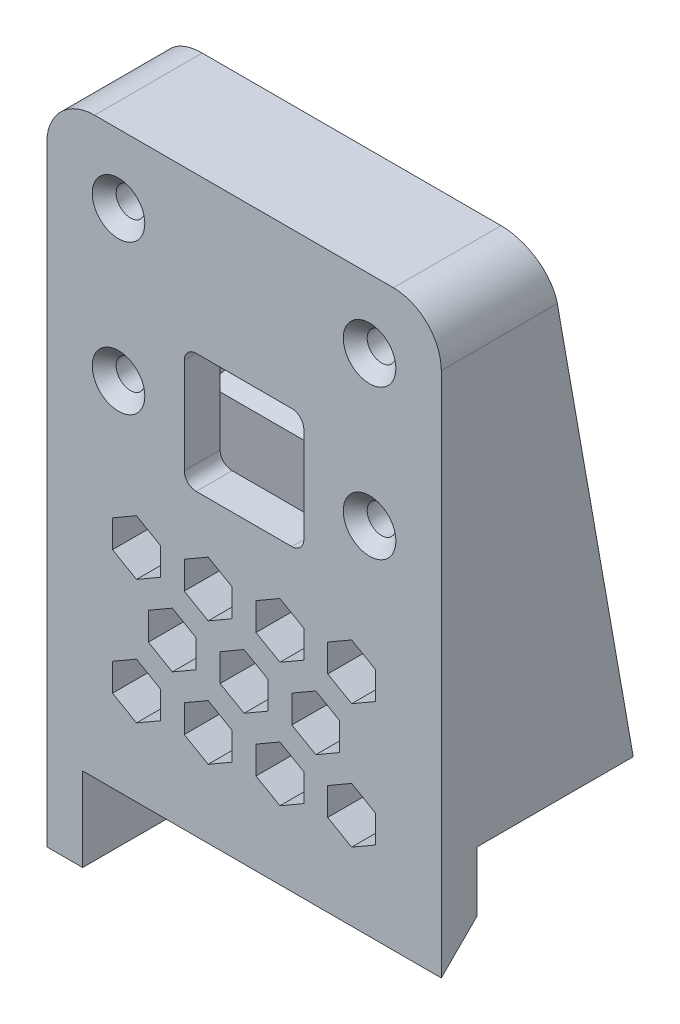
from build123d import *

# Parameters (mm, degrees)
SKETCH1_W                                       = 33
SKETCH1_H                                       = 40
BOSS_EXTRUDE1_DEPTH                             = 3
SKETCH2_W                                       = 33
SKETCH2_H                                       = 40
SKETCH2_W_2                                     = 27
SKETCH2_H_2                                     = 34
BOSS_EXTRUDE2_DEPTH                             = 3
SKETCH3_W                                       = 10
SKETCH3_H                                       = 10
CUT_EXTRUDE1_DEPTH                              = 3
CSK_FOR_M2_FLAT_HEAD_MACHINE_SCREW1_D           = 2.4
CSK_FOR_M2_FLAT_HEAD_MACHINE_SCREW1_DEPTH       = 5
CSK_FOR_M2_FLAT_HEAD_MACHINE_SCREW1_CSINK_D     = 4.4
CSK_FOR_M2_FLAT_HEAD_MACHINE_SCREW1_CSINK_ANGLE = 90
CSK_FOR_M2_FLAT_HEAD_MACHINE_SCREW1_TIP         = 0.721032743
BOSS_EXTRUDE4_DEPTH                             = 3
FILLET1_R                                       = 1
BOSS_EXTRUDE5_REACH                             = 29.809
SKETCH15_W                                      = 27
SKETCH15_H                                      = 3
SKETCH16_W                                      = 27
SKETCH16_H                                      = 3
CUT_EXTRUDE6_DEPTH                              = 3
SKETCH18_W                                      = 27
SKETCH18_H                                      = 10
BOSS_EXTRUDE6_DEPTH                             = 3
FILLET2_R                                       = 4
FILLET3_R                                       = 2
SKETCH21_W                                      = 16.053079228
SKETCH21_H                                      = 15
BOSS_EXTRUDE7_DEPTH                             = 3
CUT_EXTRUDE10_DEPTH                             = 10
SKETCH23_W                                      = 30
SKETCH23_H                                      = 8
BOSS_EXTRUDE8_DEPTH                             = 3
CHAMFER5_SIZE                                   = 3
CHAMFER6_SIZE                                   = 1
CUT_EXTRUDE12_DEPTH                             = 10


with BuildPart() as part:
    # Sketch1 → Boss-Extrude1 (new body)
    with BuildSketch(Plane.XY):
        Rectangle(SKETCH1_W, SKETCH1_H)
    extrude(amount=-BOSS_EXTRUDE1_DEPTH)

    # Sketch2 → Boss-Extrude2 (add)
    with BuildSketch(Plane(origin=(0, 0, -3), x_dir=(-1, 0, 0), z_dir=(0, 0, -1))):
        Rectangle(SKETCH2_W, SKETCH2_H)
        Rectangle(SKETCH2_W_2, SKETCH2_H_2, mode=Mode.SUBTRACT)
    extrude(amount=BOSS_EXTRUDE2_DEPTH)

    # Sketch3 → Cut-Extrude1 (cut)
    with BuildSketch(Plane.XY):
        with Locations((0, 2)):
            Rectangle(SKETCH3_W, SKETCH3_H)
    extrude(amount=-CUT_EXTRUDE1_DEPTH, mode=Mode.SUBTRACT)

    # CSK for M2 Flat Head Machine Screw1
    with Locations(Plane.XY):
        with Locations((10.5, 1.75), (10.5, 14.25), (-10.5, 1.75), (-10.5, 14.25)):
            CounterSinkHole(CSK_FOR_M2_FLAT_HEAD_MACHINE_SCREW1_D / 2, CSK_FOR_M2_FLAT_HEAD_MACHINE_SCREW1_CSINK_D / 2, depth=CSK_FOR_M2_FLAT_HEAD_MACHINE_SCREW1_DEPTH, counter_sink_angle=CSK_FOR_M2_FLAT_HEAD_MACHINE_SCREW1_CSINK_ANGLE)
            with Locations((0, 0, -(CSK_FOR_M2_FLAT_HEAD_MACHINE_SCREW1_DEPTH + CSK_FOR_M2_FLAT_HEAD_MACHINE_SCREW1_TIP / 2))):  # 118° drill point
                Cone(0, CSK_FOR_M2_FLAT_HEAD_MACHINE_SCREW1_D / 2, CSK_FOR_M2_FLAT_HEAD_MACHINE_SCREW1_TIP, mode=Mode.SUBTRACT)

    # Sketch11 → Boss-Extrude4 (add)
    with BuildSketch(Plane.ZY.offset(16.5)):
        Polygon((-6, 20), (-9, 20), (-16.053079228, -20), (-6, -20), align=None)
    boss_extrude4 = extrude(amount=-BOSS_EXTRUDE4_DEPTH)

    # Mirror1: Boss-Extrude4 across plane
    add(boss_extrude4.mirror(Plane(origin=(0, 0, 0), x_dir=(0, 0, 1), z_dir=(1, 0, 0))))

    # Fillet1
    fillet1_edges = [part.edges().sort_by_distance(p)[0] for p in [
        (5, 7, -1.5),
        (5, -3, -1.5),
        (-5, -3, -1.5),
        (-5, 7, -1.5),
    ]]
    fillet(fillet1_edges, radius=FILLET1_R)

    # Boss-Extrude5: up to this face of the body (flat: up to its plane)
    boss_extrude5_end = Plane(part.part.faces().sort_by_distance((15, 0, -12.526539614))[0])
    # Sketch15 → Boss-Extrude5 (add, up to the picked face)
    with BuildSketch(Plane(origin=(0, 0, -6), x_dir=(-1, 0, 0), z_dir=(0, 0, -1)), mode=Mode.PRIVATE) as boss_extrude5_sk1:
        with Locations((0, 18.5)):
            Rectangle(SKETCH15_W, SKETCH15_H)
    boss_extrude5_tool1 = split(extrude(boss_extrude5_sk1.sketch, amount=BOSS_EXTRUDE5_REACH, mode=Mode.PRIVATE), bisect_by=boss_extrude5_end, keep=Keep.BOTH, mode=Mode.PRIVATE)
    add(boss_extrude5_tool1.solids().sort_by(Axis((0, 18.5, -6), (0, 0, -1)))[0])

    # Sketch16 → Cut-Extrude6 (cut)
    with BuildSketch(Plane.XZ.offset(20)):
        with Locations((0, -4.5)):
            Rectangle(SKETCH16_W, SKETCH16_H)
    extrude(amount=-CUT_EXTRUDE6_DEPTH, mode=Mode.SUBTRACT)

    # Sketch18 → Boss-Extrude6 (add)
    with BuildSketch(Plane(origin=(0, 2.142164437, -12.148818227), x_dir=(-1, 0, 0), z_dir=(0, 0.17364817766692342, -0.9848077530122092))):
        with Locations((0, -11.912958374)):
            Rectangle(SKETCH18_W, SKETCH18_H)
    extrude(amount=-BOSS_EXTRUDE6_DEPTH)

    # Fillet2
    fillet2_edges = [part.edges().sort_by_distance(p)[0] for p in [
        (-16.5, 20, -4.5),
        (16.5, 20, -4.5),
    ]]
    fillet(fillet2_edges, radius=FILLET2_R)

    # Fillet3
    fillet3_edges = [part.edges().sort_by_distance(p)[0] for p in [
        (-13.5, 17, -6.264490471),
        (13.5, 17, -6.264490471),
    ]]
    fillet(fillet3_edges, radius=FILLET3_R)

    # Sketch21 → Boss-Extrude7 (add)
    with BuildSketch(Plane.ZY.offset(16.5)):
        with Locations((-8.026539614, -27.5)):
            Rectangle(SKETCH21_W, SKETCH21_H)
    extrude(amount=-BOSS_EXTRUDE7_DEPTH)

    # Sketch22 → Cut-Extrude10 (cut)
    with BuildSketch(Plane.ZY.offset(16.5)):
        with BuildLine():
            Line((-9.526539614, -29.555), (-9.526539614, -24.445))
            ThreePointArc((-9.526539614, -24.445), (-8.026539614, -22.945), (-6.526539614, -24.445))
            Line((-6.526539614, -24.445), (-6.526539614, -29.555))
            ThreePointArc((-6.526539614, -29.555), (-8.026539614, -31.055), (-9.526539614, -29.555))
        make_face()
    extrude(amount=-CUT_EXTRUDE10_DEPTH, mode=Mode.SUBTRACT)

    # Sketch23 → Boss-Extrude8 (add)
    with BuildSketch(Plane.XY):
        with Locations((1.5, -24)):
            Rectangle(SKETCH23_W, SKETCH23_H)
    extrude(amount=-BOSS_EXTRUDE8_DEPTH)

    # Chamfer5
    chamfer5_edges = [part.edges().sort_by_distance(p)[0] for p in [
        (1.5, -28, -3),
    ]]
    chamfer(chamfer5_edges, length=CHAMFER5_SIZE - 0.0001)  # a hair under: the kernel refuses the full size

    # Chamfer6
    chamfer6_edges = [part.edges().sort_by_distance(p)[0] for p in [
        (-16.5, -31.055, -8.026539614),
        (-16.5, -27, -6.526539614),
        (-16.5, -22.945, -8.026539614),
        (-16.5, -27, -9.526539614),
    ]]
    chamfer(chamfer6_edges, length=CHAMFER6_SIZE)

    # Sketch25 → Cut-Extrude12 (cut)
    with BuildSketch(Plane.XY):
        Polygon((-1, -8.414816681), (-3, -7.260116142), (-5, -8.414816681), (-5, -10.724217758), (-3, -11.878918296), (-1, -10.724217758), align=None)
        Polygon((-7, -8.414816681), (-9, -7.260116142), (-11, -8.414816681), (-11, -10.724217758), (-9, -11.878918296), (-7, -10.724217758), align=None)
        Polygon((1, -10.724217758), (1, -8.414816681), (3, -7.260116142), (5, -8.414816681), (5, -10.724217758), (3, -11.878918296), align=None)
        Polygon((7, -10.724217758), (7, -8.414816681), (9, -7.260116142), (11, -8.414816681), (11, -10.724217758), (9, -11.878918296), align=None)
        Polygon((0, -12.456268565), (-2, -13.610969104), (-2, -15.92037018), (0, -17.075070719), (2, -15.92037018), (2, -13.610969104), align=None)
        Polygon((-6, -12.456268565), (-8, -13.610969104), (-8, -15.92037018), (-6, -17.075070719), (-4, -15.92037018), (-4, -13.610969104), align=None)
        Polygon((6, -12.456268565), (4, -13.610969104), (4, -15.92037018), (6, -17.075070719), (8, -15.92037018), (8, -13.610969104), align=None)
        Polygon((1, -21.116522603), (3, -22.271223141), (5, -21.116522603), (5, -18.807121526), (3, -17.652420988), (1, -18.807121526), align=None)
        Polygon((7, -21.116522603), (9, -22.271223141), (11, -21.116522603), (11, -18.807121526), (9, -17.652420988), (7, -18.807121526), align=None)
        Polygon((-1, -18.807121526), (-1, -21.116522603), (-3, -22.271223141), (-5, -21.116522603), (-5, -18.807121526), (-3, -17.652420988), align=None)
        Polygon((-7, -18.807121526), (-7, -21.116522603), (-9, -22.271223141), (-11, -21.116522603), (-11, -18.807121526), (-9, -17.652420988), align=None)
    extrude(amount=-CUT_EXTRUDE12_DEPTH, mode=Mode.SUBTRACT)


solid = part.part
